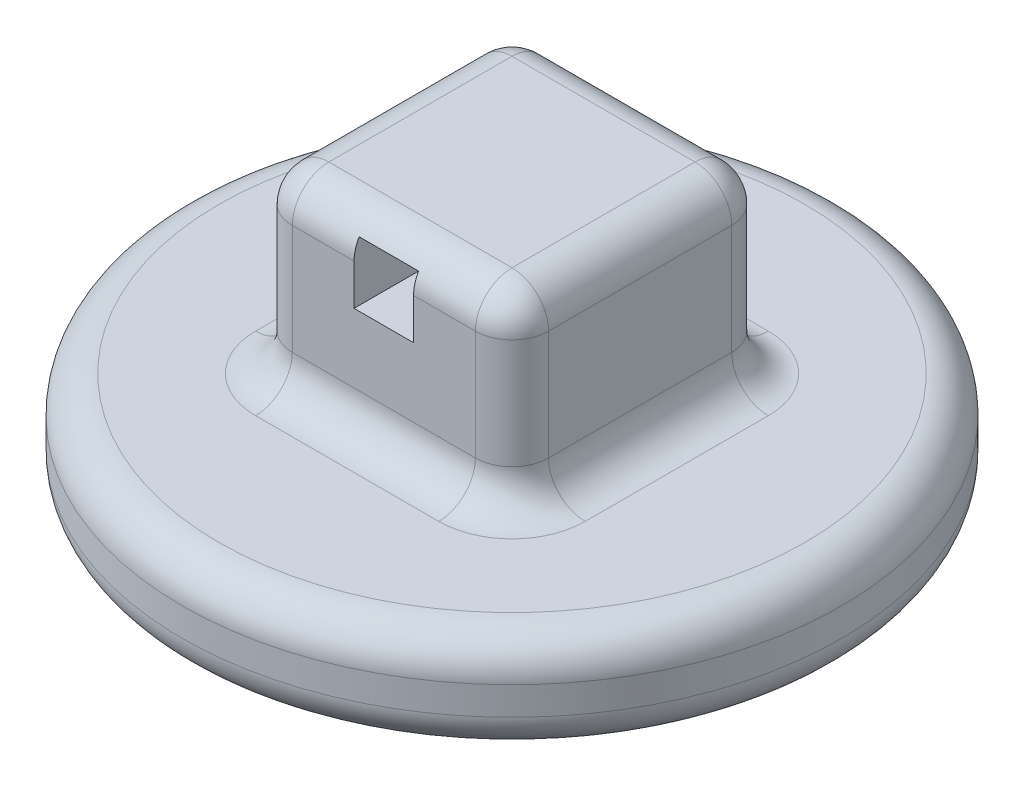
from build123d import *

# Parameters (mm, degrees)
SKETCH2_R           = 18
BOSS_EXTRUDE1_DEPTH = 3.3
SKETCH3_W           = 14
SKETCH3_H           = 14
BOSS_EXTRUDE2_DEPTH = 10
SKETCH12_R          = 1.725
CUT_EXTRUDE2_DEPTH  = 10
SKETCH13_R          = 5.075
CUT_EXTRUDE4_DEPTH  = 3
BOSS_EXTRUDE3_START = 2.24
SKETCH17_R          = 18
SKETCH17_R_2        = 13.885
SKETCH17_R_3        = 9.405
SKETCH17_R_4        = 5.075
BOSS_EXTRUDE3_DEPTH = 2.24
FILLET8_R           = 2.24
FILLET7_R           = 2
SKETCH21_W          = 3.25
SKETCH21_H          = 3.25
CUT_EXTRUDE6_DEPTH  = 4
FILLET9_R           = 2


# Some blends are built 0.0001 mm under size
with BuildPart() as part:
    # Sketch2 → Boss-Extrude1 (new body)
    with BuildSketch(Plane(origin=(0, 0, 0), x_dir=(1, 0, 0), z_dir=(0, 1, 0))):
        with Locations(Location((0, 0, 0), (0, 0, 270))):
            Circle(SKETCH2_R)
    extrude(amount=BOSS_EXTRUDE1_DEPTH)

    # Sketch3 → Boss-Extrude2 (add)
    with BuildSketch(Plane(origin=(0, 3.3, 0), x_dir=(1, 0, 0), z_dir=(0, 1, 0))):
        Rectangle(SKETCH3_W, SKETCH3_H)
    extrude(amount=BOSS_EXTRUDE2_DEPTH)

    # Sketch12 → Cut-Extrude2 (cut)
    with BuildSketch(Plane.XZ):
        with Locations(Location((0, 0, 0), (0, 0, 270))):
            Circle(SKETCH12_R)
    extrude(amount=-CUT_EXTRUDE2_DEPTH, mode=Mode.SUBTRACT)

    # Sketch13 → Cut-Extrude4 (cut)
    with BuildSketch(Plane.XZ):
        with Locations(Location((0, 0, 0), (0, 0, 270))):
            Circle(SKETCH13_R)
    extrude(amount=-CUT_EXTRUDE4_DEPTH, mode=Mode.SUBTRACT)

    # Sketch17 → Boss-Extrude3 (add)
    # profile 1 of 2: a face of its own
    with BuildSketch(Plane.XZ.offset(BOSS_EXTRUDE3_START)):
        with Locations(Location((0, 0, 0), (0, 0, 270))):
            Circle(SKETCH17_R)
        with Locations(Location((0, 0, 0), (0, 0, 270))):
            Circle(SKETCH17_R_2, mode=Mode.SUBTRACT)
    # profile 2 of 2: a face of its own
    with BuildSketch(Plane.XZ.offset(BOSS_EXTRUDE3_START)):
        with Locations(Location((0, 0, 0), (0, 0, 90))):
            Circle(SKETCH17_R_3)
        with Locations(Location((0, 0, 0), (0, 0, 270))):
            Circle(SKETCH17_R_4, mode=Mode.SUBTRACT)
    extrude(amount=-BOSS_EXTRUDE3_DEPTH)

    # Fillet8
    fillet8_edges = [part.edges().sort_by_distance(p)[0] for p in [
        (0, 0, 13.885),
        (0, 0, -9.405),
    ]]
    fillet(fillet8_edges, radius=FILLET8_R - 0.0001)  # a hair under: the kernel refuses the full size

    # Fillet7
    fillet7_edges = [part.edges().sort_by_distance(p)[0] for p in [
        (0, 3, 5.075),
    ]]
    fillet(fillet7_edges, radius=FILLET7_R)

    # Sketch21 → Cut-Extrude6 (cut)
    with BuildSketch(Plane(origin=(0, 0, -7), x_dir=(-1, 0, 0), z_dir=(0, 0, -1))):
        with Locations((0, 10.69)):
            Rectangle(SKETCH21_W, SKETCH21_H)
    cut_extrude6 = extrude(amount=-CUT_EXTRUDE6_DEPTH, mode=Mode.SUBTRACT)

    # Mirror2: Cut-Extrude6 across plane
    add(cut_extrude6.mirror(Plane.XY), mode=Mode.SUBTRACT)

    # Fillet9
    # the kernel refuses this fillet: 2 mm, written as the material it takes off along each edge
    with BuildSketch(Plane(origin=(5, 11.3, 5), x_dir=(1, 0, 0), z_dir=(0, 0, 1))) as fillet9_piece_1_section:
        Polygon((0, 0), (FILLET9_R, 0), (FILLET9_R, FILLET9_R), (0, FILLET9_R), align=None)
    fillet9_piece_1 = extrude(amount=FILLET9_R, mode=Mode.PRIVATE)
    fillet9_piece_1 = fillet9_piece_1 - Plane(origin=(5, 11.3, 5), x_dir=(-0.7071067811865475, -0.7071067811865475, 0), z_dir=(0, 0, 1)) * Sphere(FILLET9_R, mode=Mode.PRIVATE)
    add(fillet9_piece_1, mode=Mode.SUBTRACT)
    with BuildSketch(Plane(origin=(-5, 11.3, 5), x_dir=(0, 1, 0), z_dir=(0, 0, 1))) as fillet9_piece_2_section:
        Polygon((0, 0), (FILLET9_R, 0), (FILLET9_R, FILLET9_R), (0, FILLET9_R), align=None)
    fillet9_piece_2 = extrude(amount=FILLET9_R, mode=Mode.PRIVATE)
    fillet9_piece_2 = fillet9_piece_2 - Plane(origin=(-5, 11.3, 5), x_dir=(0.7071067811865475, -0.7071067811865475, 0), z_dir=(0, 0, 1)) * Sphere(FILLET9_R, mode=Mode.PRIVATE)
    add(fillet9_piece_2, mode=Mode.SUBTRACT)
    with BuildSketch(Plane(origin=(-5, 11.3, -5), x_dir=(0, 1, 0), z_dir=(0, 0, -1))) as fillet9_piece_3_section:
        Polygon((0, 0), (FILLET9_R, 0), (FILLET9_R, -FILLET9_R), (0, -FILLET9_R), align=None)
    fillet9_piece_3 = extrude(amount=FILLET9_R, mode=Mode.PRIVATE)
    fillet9_piece_3 = fillet9_piece_3 - Plane(origin=(-5, 11.3, -5), x_dir=(0.7071067811865475, -0.7071067811865475, 0), z_dir=(0, 0, -1)) * Sphere(FILLET9_R, mode=Mode.PRIVATE)
    add(fillet9_piece_3, mode=Mode.SUBTRACT)
    with BuildSketch(Plane(origin=(5, 11.3, -5), x_dir=(0, 0, -1), z_dir=(1, 0, 0))) as fillet9_piece_4_section:
        Polygon((0, 0), (FILLET9_R, 0), (FILLET9_R, FILLET9_R), (0, FILLET9_R), align=None)
    fillet9_piece_4 = extrude(amount=FILLET9_R, mode=Mode.PRIVATE)
    fillet9_piece_4 = fillet9_piece_4 - Plane(origin=(5, 11.3, -5), x_dir=(0, -0.7071067811865475, 0.7071067811865475), z_dir=(1, 0, 0)) * Sphere(FILLET9_R, mode=Mode.PRIVATE)
    add(fillet9_piece_4, mode=Mode.SUBTRACT)
    with BuildSketch(Plane(origin=(5, 13.3, 7), x_dir=(0, -1, 0), z_dir=(-1, 0, 0)), Plane(origin=(-7, 13.3, 5), x_dir=(0, -1, 0), z_dir=(0, 0, -1)), Plane(origin=(-5, 13.3, -7), x_dir=(0, -1, 0), z_dir=(1, 0, 0)), Plane(origin=(7, 13.3, -5), x_dir=(0, -1, 0), z_dir=(0, 0, 1))) as fillet9_piece_5:
        with BuildLine():
            CenterArc((FILLET9_R, -FILLET9_R), FILLET9_R, 90, 90)
            Line((0, -FILLET9_R), (0, 0))
            Line((0, 0), (FILLET9_R, 0))
        make_face()
    extrude(amount=10, mode=Mode.SUBTRACT)
    with BuildSketch(Plane(origin=(0, -2.24, 0), x_dir=(0, 0, -1), z_dir=(-1, 0, 0))) as fillet9_piece_6:
        with BuildLine():
            CenterArc((18 - FILLET9_R, -FILLET9_R), FILLET9_R, 0, 90)
            Line((18, -FILLET9_R), (18, 0))
            Line((18, 0), (18 - FILLET9_R, 0))
        make_face()
    revolve(axis=Axis((0, -2.24, 0), (0, -1, 0)), mode=Mode.SUBTRACT)
    with BuildSketch(Plane(origin=(0, 3.3, 0), x_dir=(0, 0, 1), z_dir=(-1, 0, 0))) as fillet9_piece_7:
        with BuildLine():
            CenterArc((18 - FILLET9_R, -FILLET9_R), FILLET9_R, 0, 90)
            Line((18 - FILLET9_R, 0), (18, 0))
            Line((18, 0), (18, -FILLET9_R))
        make_face()
    revolve(axis=Axis((0, 3.3, 0), (0, 1, 0)), mode=Mode.SUBTRACT)
    with BuildSketch(Plane(origin=(7, 3.3, 7), x_dir=(-1, 0, 0), z_dir=(0, 1, 0)), Plane(origin=(-7, 3.3, 7), x_dir=(0, 0, -1), z_dir=(0, 1, 0)), Plane(origin=(7, 3.3, -7), x_dir=(0, 0, 1), z_dir=(0, 1, 0))) as fillet9_piece_8:
        with BuildLine():
            CenterArc((FILLET9_R, -FILLET9_R), FILLET9_R, 90, 90)
            Line((0, -FILLET9_R), (0, 0))
            Line((0, 0), (FILLET9_R, 0))
        make_face()
    extrude(amount=8, mode=Mode.SUBTRACT)
    with BuildSketch(Plane(origin=(-7, 3.3, -7), x_dir=(0, 0, 1), z_dir=(0, 1, 0))) as fillet9_piece_9:
        with BuildLine():
            CenterArc((FILLET9_R, FILLET9_R), FILLET9_R, 180, 90)
            Line((0, FILLET9_R), (0, 0))
            Line((0, 0), (FILLET9_R, 0))
        make_face()
    extrude(amount=8, mode=Mode.SUBTRACT)
    # the kernel refuses this fillet: 2 mm, written as the material it adds along each edge
    with BuildSketch(Plane(origin=(7, 3.3, -5), x_dir=(1, 0, 0), z_dir=(0, 0, 1)), Plane(origin=(-5, 3.3, -7), x_dir=(0, 0, -1), z_dir=(1, 0, 0)), Plane(origin=(5, 3.3, 7), x_dir=(0, 0, 1), z_dir=(-1, 0, 0)), Plane(origin=(-7, 3.3, 5), x_dir=(-1, 0, 0), z_dir=(0, 0, -1))) as fillet9_2_piece_1:
        with BuildLine():
            CenterArc((FILLET9_R, FILLET9_R), FILLET9_R, 180, 90)
            Line((0, FILLET9_R), (0, 0))
            Line((0, 0), (FILLET9_R, 0))
        make_face()
    extrude(amount=10)
    with BuildSketch(Plane(origin=(-5, 3.3, 5), x_dir=(-1, 0, 0), z_dir=(0, 0, -1))) as fillet9_2_piece_2:
        with BuildLine():
            CenterArc((2 + FILLET9_R, FILLET9_R), FILLET9_R, 180, 90)
            Line((2, FILLET9_R), (2, 0))
            Line((2, 0), (2 + FILLET9_R, 0))
        make_face()
    revolve(axis=Axis((-5, 3.3, 5), (0, 1, 0)), revolution_arc=90)
    with BuildSketch(Plane(origin=(-5, 3.3, -5), x_dir=(-1, 0, 0), z_dir=(0, 0, 1))) as fillet9_2_piece_3:
        with BuildLine():
            CenterArc((2 + FILLET9_R, -FILLET9_R), FILLET9_R, 90, 90)
            Line((2, -FILLET9_R), (2, 0))
            Line((2, 0), (2 + FILLET9_R, 0))
        make_face()
    revolve(axis=Axis((-5, 3.3, -5), (0, -1, 0)), revolution_arc=90)
    with BuildSketch(Plane(origin=(5, 3.3, 5), x_dir=(0, 0, 1), z_dir=(-1, 0, 0))) as fillet9_2_piece_4:
        with BuildLine():
            CenterArc((2 + FILLET9_R, FILLET9_R), FILLET9_R, 180, 90)
            Line((2, FILLET9_R), (2, 0))
            Line((2, 0), (2 + FILLET9_R, 0))
        make_face()
    revolve(axis=Axis((5, 3.3, 5), (0, 1, 0)), revolution_arc=90)
    with BuildSketch(Plane(origin=(5, 3.3, -5), x_dir=(1, 0, 0), z_dir=(0, 0, 1))) as fillet9_2_piece_5:
        with BuildLine():
            CenterArc((2 + FILLET9_R, FILLET9_R), FILLET9_R, 180, 90)
            Line((2, FILLET9_R), (2, 0))
            Line((2, 0), (2 + FILLET9_R, 0))
        make_face()
    revolve(axis=Axis((5, 3.3, -5), (0, 1, 0)), revolution_arc=90)


solid = part.part
